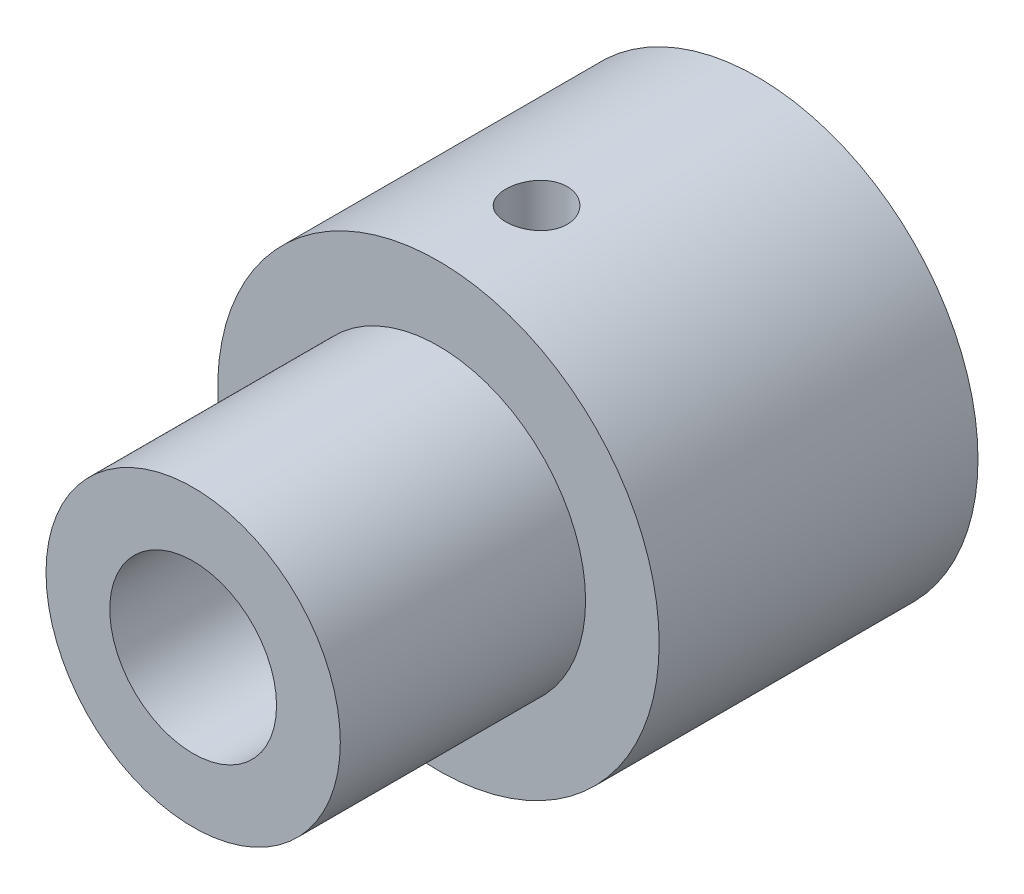
from build123d import *

# Parameters (mm, degrees)
CUT_EXTRUDE1_REACH             = 28.287
SKETCH2_R                      = 1.25
CUT_EXTRUDE1_DIRECTION_2_REACH = 28.287
TAP_DRILL_FOR_M8_TAP1_D        = 6.8
TAP_DRILL_FOR_M8_TAP1_DEPTH    = 13
TAP_DRILL_FOR_M8_TAP1_TIP      = 2.042926105


with BuildPart() as part:
    # Sketch1 → Revolve1 (revolve)
    with BuildSketch(Plane(origin=(0, 0, 0), x_dir=(0, 0, -1), z_dir=(1, 0, 0))):
        Polygon((0, 0), (10.266820387, 0), (12.5, 4.2), (23, 4.2), (23, 9), (10, 9), (10, 6), (0, 6), align=None)
    revolve(axis=Axis((0, 0, 0), (0, 0, -1)))

    # Sketch2 → Cut-Extrude1 (cut, up to next)
    with BuildSketch(Plane(origin=(0, 0, 0), x_dir=(1, 0, 0), z_dir=(0, 1, 0)), mode=Mode.PRIVATE) as cut_extrude1_sk1:
        with Locations((0, 14)):
            Circle(SKETCH2_R)
    cut_extrude1_tool1 = extrude(cut_extrude1_sk1.sketch, amount=-CUT_EXTRUDE1_REACH, mode=Mode.PRIVATE) & part.part
    add(cut_extrude1_tool1.solids().sort_by_distance((0, 0, -14))[0], mode=Mode.SUBTRACT)

    # Sketch2 → Cut-Extrude1 direction 2 (cut, up to next)
    with BuildSketch(Plane(origin=(0, 0, 0), x_dir=(1, 0, 0), z_dir=(0, 1, 0)), mode=Mode.PRIVATE) as cut_extrude1_direction_2_sk1:
        with Locations((0, 14)):
            Circle(SKETCH2_R)
    cut_extrude1_direction_2_tool1 = extrude(cut_extrude1_direction_2_sk1.sketch, amount=CUT_EXTRUDE1_DIRECTION_2_REACH, mode=Mode.PRIVATE) & part.part
    add(cut_extrude1_direction_2_tool1.solids().sort_by_distance((0, 0, -14))[0], mode=Mode.SUBTRACT)

    # Tap Drill for M8 Tap1
    with Locations(Plane.XY):
        with Locations((0, 0)):
            Hole(TAP_DRILL_FOR_M8_TAP1_D / 2, depth=TAP_DRILL_FOR_M8_TAP1_DEPTH)
            with Locations((0, 0, -(TAP_DRILL_FOR_M8_TAP1_DEPTH + TAP_DRILL_FOR_M8_TAP1_TIP / 2))):  # 118° drill point
                Cone(0, TAP_DRILL_FOR_M8_TAP1_D / 2, TAP_DRILL_FOR_M8_TAP1_TIP, mode=Mode.SUBTRACT)


solid = part.part
